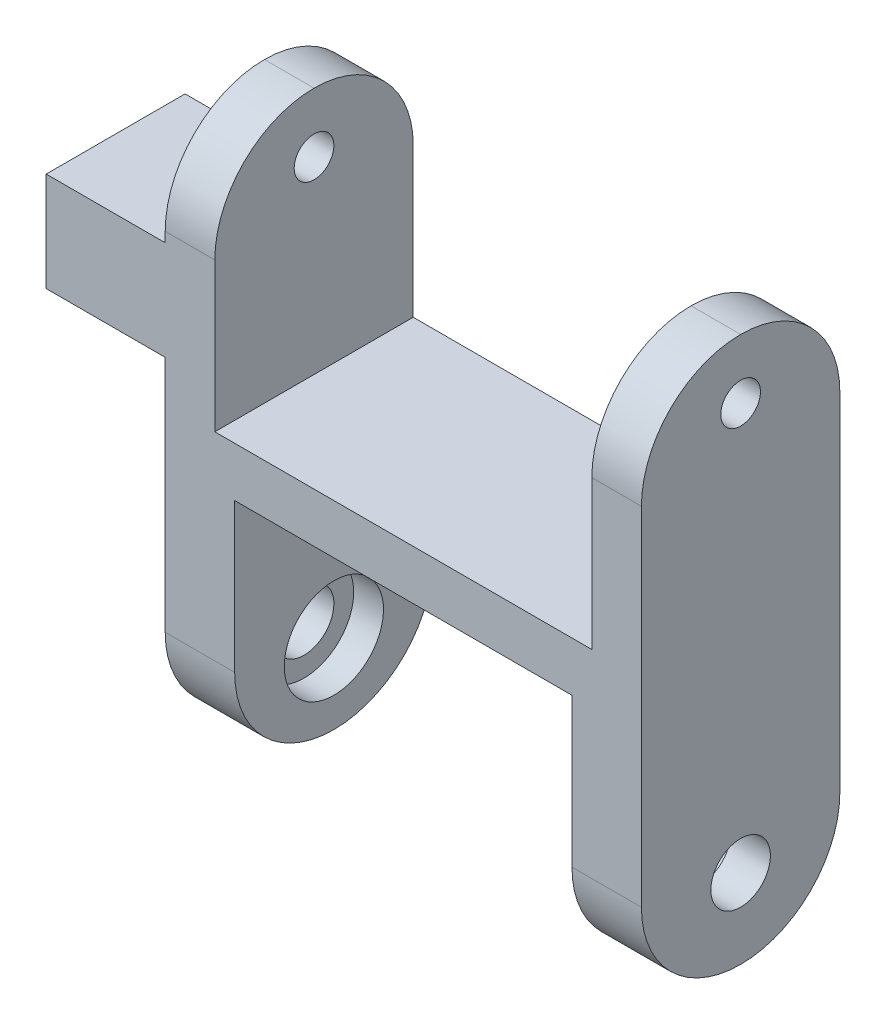
from build123d import *

# Parameters (mm, degrees)
SALIENTE_EXTRUIR1_DEPTH = 10
CROQUIS2_R              = 2.5
CORTAR_EXTRUIR1_DEPTH   = 1.5
CROQUIS3_R              = 1.5
CORTAR_EXTRUIR2_DEPTH   = 2
CORTAR_EXTRUIR3_START   = -24
CROQUIS6_R              = 1
CORTAR_EXTRUIR3_DEPTH   = 24
CROQUIS9_W              = 7
CROQUIS9_H              = 5
CROQUIS9_R              = 0.5
SALIENTE_EXTRUIR4_DEPTH = 6
CROQUIS10_W             = 3
CROQUIS10_H             = 3
CORTAR_EXTRUIR4_DEPTH   = 5
REDONDEO1_R             = 5


with BuildPart() as part:
    # Croquis1 → Saliente-Extruir1 (new body)
    with BuildSketch(Plane.XY):
        Polygon((8.5, 0), (-8.5, 0), (-8.5, -12.5), (-12, -12.5), (-12, 2.5), (-12, 15), (-9.5, 15), (-9.5, 2.5), (9.5, 2.5), (9.5, 15), (12, 15), (12, 2.5), (12, -12.5), (8.5, -12.5), align=None)
    extrude(amount=SALIENTE_EXTRUIR1_DEPTH)

    # Croquis2 → Cortar-Extruir1 (cut)
    with BuildSketch(Plane(origin=(-8.5, 0, 0), x_dir=(0, 0, -1), z_dir=(1, 0, 0))):
        with Locations(Location((-5, -8.5, 0), (0, 0, 90))):
            Circle(CROQUIS2_R)
    cortar_extruir1 = extrude(amount=-CORTAR_EXTRUIR1_DEPTH, mode=Mode.SUBTRACT)

    # Croquis3 → Cortar-Extruir2 (cut)
    with BuildSketch(Plane(origin=(-10, 0, 0), x_dir=(0, 0, -1), z_dir=(1, 0, 0))):
        with Locations(Location((-5, -8.5, 0), (0, 0, 90))):
            Circle(CROQUIS3_R)
    cortar_extruir2 = extrude(amount=-CORTAR_EXTRUIR2_DEPTH, mode=Mode.SUBTRACT)

    # Simetría1: Cortar-Extruir1, Cortar-Extruir2 across plane
    add(cortar_extruir1.mirror(Plane(origin=(0, 0, 0), x_dir=(0, 0, 1), z_dir=(1, 0, 0))), mode=Mode.SUBTRACT)
    add(cortar_extruir2.mirror(Plane(origin=(0, 0, 0), x_dir=(0, 0, 1), z_dir=(1, 0, 0))), mode=Mode.SUBTRACT)

    # Croquis6 → Cortar-Extruir3 (cut)
    with BuildSketch(Plane.ZY.offset(12).offset(CORTAR_EXTRUIR3_START)):
        with Locations((5, 12)):
            Circle(CROQUIS6_R)
    extrude(amount=CORTAR_EXTRUIR3_DEPTH, mode=Mode.SUBTRACT)

    # Croquis9 → Saliente-Extruir4 (add)
    with BuildSketch(Plane.ZY.offset(12)):
        with Locations((6.5, 7)):
            Rectangle(CROQUIS9_W, CROQUIS9_H)
        with Locations((5, 7)):
            Circle(CROQUIS9_R, mode=Mode.SUBTRACT)
    extrude(amount=SALIENTE_EXTRUIR4_DEPTH)

    # Croquis10 → Cortar-Extruir4 (cut)
    with BuildSketch(Plane.XZ.offset(-4.5)):
        with Locations((-13.5, 4.5)):
            Rectangle(CROQUIS10_W, CROQUIS10_H)
    extrude(amount=-CORTAR_EXTRUIR4_DEPTH, mode=Mode.SUBTRACT)

    # Redondeo1
    redondeo1_edges = [part.edges().sort_by_distance(p)[0] for p in [
        (10.25, -12.5, 10),
        (-10.25, -12.5, 10),
        (-10.25, -12.5, 0),
        (10.25, -12.5, 0),
        (-10.75, 15, 10),
        (-10.75, 15, 0),
        (10.75, 15, 10),
        (10.75, 15, 0),
    ]]
    fillet(redondeo1_edges, radius=REDONDEO1_R - 0.0001)  # a hair under: the kernel refuses the full size


solid = part.part
